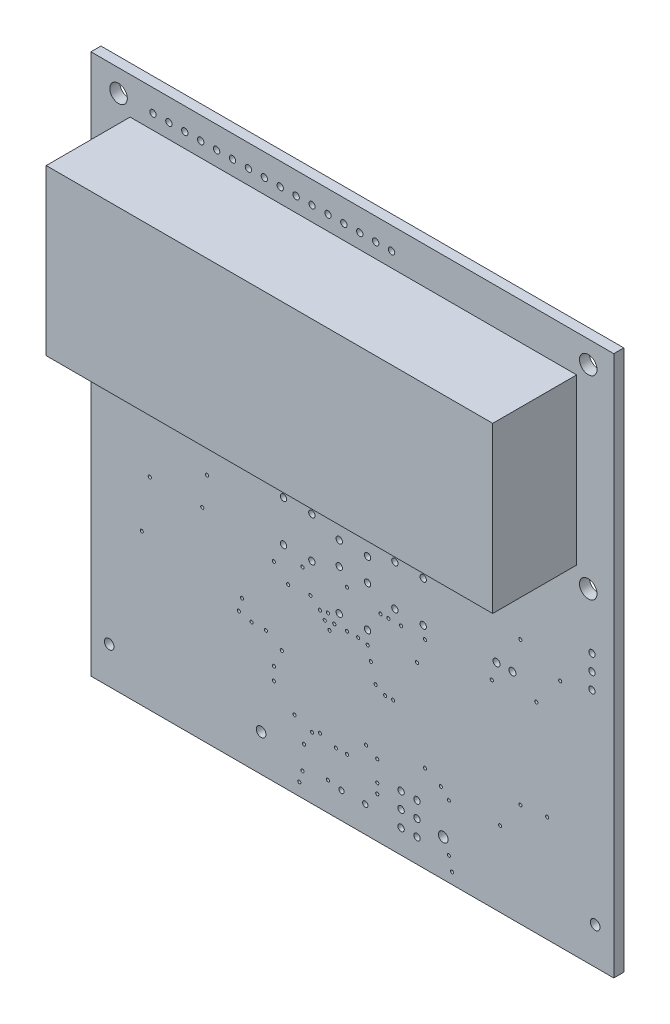
from build123d import *

# Parameters (mm, degrees)
SKETCH_20_W         = 83.49
SKETCH_20_H         = 86.34
SKETCH_20_R         = 0.425
SKETCH_20_R_2       = 0.775
SKETCH_20_R_3       = 1.4
BOSS_EXTRUDE1_DEPTH = 1.6
SKETCH_44_R         = 0.508
SKETCH_44_R_2       = 0.5588
SKETCH_44_R_3       = 0.25
CUT_EXTRUDE3_DEPTH  = 1.6
SKETCH18_W          = 71.3
SKETCH18_H          = 26.3
BOSS_EXTRUDE3_DEPTH = 15


with BuildPart() as part:
    # Sketch 20 → Boss-Extrude1 (new body)
    with BuildSketch(Plane.XY):
        with Locations((41.745, 43.19)):
            Rectangle(SKETCH_20_W, SKETCH_20_H)
        with Locations((40.01, 4.232)):
            Circle(SKETCH_20_R, mode=Mode.SUBTRACT)
        with Locations((43.81, 4.232)):
            Circle(SKETCH_20_R, mode=Mode.SUBTRACT)
        with Locations((27.18, 5.91)):
            Circle(SKETCH_20_R_2, mode=Mode.SUBTRACT)
        with Locations((2.92, 5.91)):
            Circle(SKETCH_20_R_2, mode=Mode.SUBTRACT)
        with Locations((80.52, 5.91)):
            Circle(SKETCH_20_R_2, mode=Mode.SUBTRACT)
        with Locations((56.26, 5.91)):
            Circle(SKETCH_20_R_2, mode=Mode.SUBTRACT)
        with Locations((4.41, 82.81)):
            Circle(SKETCH_20_R_3, mode=Mode.SUBTRACT)
        with Locations((4.41, 51.81)):
            Circle(SKETCH_20_R_3, mode=Mode.SUBTRACT)
        with Locations((79.41, 82.81)):
            Circle(SKETCH_20_R_3, mode=Mode.SUBTRACT)
        with Locations((79.41, 51.81)):
            Circle(SKETCH_20_R_3, mode=Mode.SUBTRACT)
    extrude(amount=BOSS_EXTRUDE1_DEPTH)

    # Sketch 44 → Cut-Extrude3 (cut)
    with BuildSketch(Plane.XY):
        with Locations((52.07, 3.81)):
            Circle(SKETCH_44_R)
        with Locations((49.53, 3.81)):
            Circle(SKETCH_44_R)
        with Locations((52.07, 6.35)):
            Circle(SKETCH_44_R)
        with Locations((49.53, 6.35)):
            Circle(SKETCH_44_R)
        with Locations((52.07, 8.89)):
            Circle(SKETCH_44_R)
        with Locations((49.53, 8.89)):
            Circle(SKETCH_44_R)
        with Locations((67.31, 34.29)):
            Circle(SKETCH_44_R_2)
        with Locations((64.77, 34.29)):
            Circle(SKETCH_44_R_2)
        with Locations((33.02, 58.42)):
            Circle(SKETCH_44_R)
        with Locations((35.56, 58.42)):
            Circle(SKETCH_44_R)
        with Locations((38.1, 58.42)):
            Circle(SKETCH_44_R)
        with Locations((40.64, 58.42)):
            Circle(SKETCH_44_R)
        with Locations((43.18, 58.42)):
            Circle(SKETCH_44_R)
        with Locations((45.72, 58.42)):
            Circle(SKETCH_44_R)
        with Locations((48.26, 58.42)):
            Circle(SKETCH_44_R)
        with Locations((50.8, 58.42)):
            Circle(SKETCH_44_R)
        with Locations((44.1706, 35.0012)):
            Circle(SKETCH_44_R)
        with Locations((44.1706, 28.4988)):
            Circle(SKETCH_44_R)
        with Locations((39.6494, 35.0012)):
            Circle(SKETCH_44_R)
        with Locations((39.6494, 28.4988)):
            Circle(SKETCH_44_R)
        with Locations((44.1706, 45.1612)):
            Circle(SKETCH_44_R)
        with Locations((44.1706, 38.6588)):
            Circle(SKETCH_44_R)
        with Locations((39.6494, 45.1612)):
            Circle(SKETCH_44_R)
        with Locations((39.6494, 38.6588)):
            Circle(SKETCH_44_R)
        with Locations((53.0606, 40.0812)):
            Circle(SKETCH_44_R)
        with Locations((53.0606, 33.5788)):
            Circle(SKETCH_44_R)
        with Locations((48.5394, 40.0812)):
            Circle(SKETCH_44_R)
        with Locations((48.5394, 33.5788)):
            Circle(SKETCH_44_R)
        with Locations((35.2806, 40.0812)):
            Circle(SKETCH_44_R)
        with Locations((35.2806, 33.5788)):
            Circle(SKETCH_44_R)
        with Locations((30.7594, 40.0812)):
            Circle(SKETCH_44_R)
        with Locations((30.7594, 33.5788)):
            Circle(SKETCH_44_R)
        with Locations((80.01, 43.18)):
            Circle(SKETCH_44_R)
        with Locations((80.01, 40.64)):
            Circle(SKETCH_44_R)
        with Locations((80.01, 38.1)):
            Circle(SKETCH_44_R)
        with Locations((9.91, 82.81)):
            Circle(SKETCH_44_R)
        with Locations((12.45, 82.81)):
            Circle(SKETCH_44_R)
        with Locations((14.99, 82.81)):
            Circle(SKETCH_44_R)
        with Locations((17.53, 82.81)):
            Circle(SKETCH_44_R)
        with Locations((20.07, 82.81)):
            Circle(SKETCH_44_R)
        with Locations((22.61, 82.81)):
            Circle(SKETCH_44_R)
        with Locations((25.15, 82.81)):
            Circle(SKETCH_44_R)
        with Locations((27.69, 82.81)):
            Circle(SKETCH_44_R)
        with Locations((30.23, 82.81)):
            Circle(SKETCH_44_R)
        with Locations((32.77, 82.81)):
            Circle(SKETCH_44_R)
        with Locations((35.31, 82.81)):
            Circle(SKETCH_44_R)
        with Locations((37.85, 82.81)):
            Circle(SKETCH_44_R)
        with Locations((40.39, 82.81)):
            Circle(SKETCH_44_R)
        with Locations((42.93, 82.81)):
            Circle(SKETCH_44_R)
        with Locations((45.47, 82.81)):
            Circle(SKETCH_44_R)
        with Locations((48.01, 82.81)):
            Circle(SKETCH_44_R)
        with Locations((25.654, 20.32)):
            Circle(SKETCH_44_R_3)
        with Locations((45.72, 11.43)):
            Circle(SKETCH_44_R_3)
        with Locations((31.496, 28.448)):
            Circle(SKETCH_44_R_3)
        with Locations((44.704, 24.384)):
            Circle(SKETCH_44_R_3)
        with Locations((30.48, 18.796)):
            Circle(SKETCH_44_R_3)
        with Locations((68.58, 16.51)):
            Circle(SKETCH_44_R_3)
        with Locations((29.21, 16.002)):
            Circle(SKETCH_44_R_3)
        with Locations((67.31, 59.69)):
            Circle(SKETCH_44_R_3)
        with Locations((69.85, 64.77)):
            Circle(SKETCH_44_R_3)
        with Locations((48.26, 60.96)):
            Circle(SKETCH_44_R_3)
        with Locations((52.07, 64.77)):
            Circle(SKETCH_44_R_3)
        with Locations((34.29, 64.77)):
            Circle(SKETCH_44_R_3)
        with Locations((39.878, 49.784)):
            Circle(SKETCH_44_R_3)
        with Locations((37.465, 61.595)):
            Circle(SKETCH_44_R_3)
        with Locations((41.402, 49.784)):
            Circle(SKETCH_44_R_3)
        with Locations((21.59, 59.69)):
            Circle(SKETCH_44_R_3)
        with Locations((16.51, 64.77)):
            Circle(SKETCH_44_R_3)
        with Locations((42.672, 49.784)):
            Circle(SKETCH_44_R_3)
        with Locations((43.942, 49.784)):
            Circle(SKETCH_44_R_3)
        with Locations((36.576, 10.414)):
            Circle(SKETCH_44_R_3)
        with Locations((40.894, 9.652)):
            Circle(SKETCH_44_R_3)
        with Locations((35.306, 9.906)):
            Circle(SKETCH_44_R_3)
        with Locations((39.116, 9.652)):
            Circle(SKETCH_44_R_3)
        with Locations((62.23, 46.99)):
            Circle(SKETCH_44_R_3)
        with Locations((48.26, 20.828)):
            Circle(SKETCH_44_R_3)
        with Locations((24.13, 22.86)):
            Circle(SKETCH_44_R_3)
        with Locations((40.894, 26.67)):
            Circle(SKETCH_44_R_3)
        with Locations((40.894, 32.766)):
            Circle(SKETCH_44_R_3)
        with Locations((37.846, 27.686)):
            Circle(SKETCH_44_R_3)
        with Locations((47.498, 31.75)):
            Circle(SKETCH_44_R_3)
        with Locations((49.53, 31.75)):
            Circle(SKETCH_44_R_3)
        with Locations((53.34, 31.75)):
            Circle(SKETCH_44_R_3)
        with Locations((64.008, 31.496)):
            Circle(SKETCH_44_R_3)
        with Locations((8.128, 24.13)):
            Circle(SKETCH_44_R_3)
        with Locations((38.862, 26.67)):
            Circle(SKETCH_44_R_3)
        with Locations((55.88, 12.7)):
            Circle(SKETCH_44_R_3)
        with Locations((32.512, 10.922)):
            Circle(SKETCH_44_R_3)
        with Locations((67.945, 78.105)):
            Circle(SKETCH_44_R_3)
        with Locations((59.055, 78.105)):
            Circle(SKETCH_44_R_3)
        with Locations((50.165, 78.105)):
            Circle(SKETCH_44_R_3)
        with Locations((41.275, 78.105)):
            Circle(SKETCH_44_R_3)
        with Locations((35.687, 74.295)):
            Circle(SKETCH_44_R_3)
        with Locations((23.495, 78.105)):
            Circle(SKETCH_44_R_3)
        with Locations((5.715, 78.105)):
            Circle(SKETCH_44_R_3)
        with Locations((14.605, 78.105)):
            Circle(SKETCH_44_R_3)
        with Locations((13.208, 65.532)):
            Circle(SKETCH_44_R_3)
        with Locations((48.768, 65.532)):
            Circle(SKETCH_44_R_3)
        with Locations((66.548, 65.532)):
            Circle(SKETCH_44_R_3)
        with Locations((57.658, 65.532)):
            Circle(SKETCH_44_R_3)
        with Locations((75.438, 65.532)):
            Circle(SKETCH_44_R_3)
        with Locations((39.878, 65.532)):
            Circle(SKETCH_44_R_3)
        with Locations((22.098, 65.532)):
            Circle(SKETCH_44_R_3)
        with Locations((69.088, 61.722)):
            Circle(SKETCH_44_R_3)
        with Locations((51.308, 61.976)):
            Circle(SKETCH_44_R_3)
        with Locations((34.29, 62.23)):
            Circle(SKETCH_44_R_3)
        with Locations((15.748, 61.722)):
            Circle(SKETCH_44_R_3)
        with Locations((61.976, 42.926)):
            Circle(SKETCH_44_R_3)
        with Locations((68.58, 39.37)):
            Circle(SKETCH_44_R_3)
        with Locations((71.12, 32.004)):
            Circle(SKETCH_44_R_3)
        with Locations((38.862, 56.134)):
            Circle(SKETCH_44_R_3)
        with Locations((48.006, 52.324)):
            Circle(SKETCH_44_R_3)
        with Locations((48.006, 47.244)):
            Circle(SKETCH_44_R_3)
        with Locations((66.04, 49.53)):
            Circle(SKETCH_44_R_3)
        with Locations((52.07, 27.94)):
            Circle(SKETCH_44_R_3)
        with Locations((53.34, 13.97)):
            Circle(SKETCH_44_R_3)
        with Locations((45.72, 6.604)):
            Circle(SKETCH_44_R_3)
        with Locations((34.036, 7.62)):
            Circle(SKETCH_44_R_3)
        with Locations((9.398, 32.258)):
            Circle(SKETCH_44_R_3)
        with Locations((17.78, 32.258)):
            Circle(SKETCH_44_R_3)
        with Locations((18.542, 37.084)):
            Circle(SKETCH_44_R_3)
        with Locations((33.782, 32.004)):
            Circle(SKETCH_44_R_3)
        with Locations((35.56, 69.85)):
            Circle(SKETCH_44_R_3)
        with Locations((49.53, 45.72)):
            Circle(SKETCH_44_R_3)
        with Locations((29.21, 13.97)):
            Circle(SKETCH_44_R_3)
        with Locations((42.672, 26.67)):
            Circle(SKETCH_44_R_3)
        with Locations((8.89, 44.45)):
            Circle(SKETCH_44_R_3)
        with Locations((36.576, 27.432)):
            Circle(SKETCH_44_R_3)
        with Locations((29.21, 30.48)):
            Circle(SKETCH_44_R_3)
        with Locations((27.94, 20.32)):
            Circle(SKETCH_44_R_3)
        with Locations((43.942, 12.446)):
            Circle(SKETCH_44_R_3)
        with Locations((31.75, 41.91)):
            Circle(SKETCH_44_R_3)
        with Locations((35.052, 28.702)):
            Circle(SKETCH_44_R_3)
        with Locations((37.338, 26.416)):
            Circle(SKETCH_44_R_3)
        with Locations((38.1, 25.4)):
            Circle(SKETCH_44_R_3)
        with Locations((33.274, 2.032)):
            Circle(SKETCH_44_R_3)
        with Locations((23.622, 20.828)):
            Circle(SKETCH_44_R_3)
        with Locations((72.85, 16.97)):
            Circle(SKETCH_44_R_3)
        with Locations((57.658, 1.778)):
            Circle(SKETCH_44_R_3)
        with Locations((74.93, 36.83)):
            Circle(SKETCH_44_R_3)
        with Locations((64.77, 58.42)):
            Circle(SKETCH_44_R_3)
        with Locations((8.89, 67.31)):
            Circle(SKETCH_44_R_3)
        with Locations((45.72, 8.128)):
            Circle(SKETCH_44_R_3)
        with Locations((33.782, 3.81)):
            Circle(SKETCH_44_R_3)
        with Locations((57.15, 3.81)):
            Circle(SKETCH_44_R_3)
        with Locations((65.35, 12.01)):
            Circle(SKETCH_44_R_3)
        with Locations((39.37, 41.91)):
            Circle(SKETCH_44_R_3)
        with Locations((44.196, 26.416)):
            Circle(SKETCH_44_R_3)
        with Locations((49.53, 53.34)):
            Circle(SKETCH_44_R_3)
        with Locations((45.466, 21.59)):
            Circle(SKETCH_44_R_3)
        with Locations((46.99, 20.828)):
            Circle(SKETCH_44_R_3)
        with Locations((46.228, 31.75)):
            Circle(SKETCH_44_R_3)
        with Locations((57.15, 11.43)):
            Circle(SKETCH_44_R_3)
        with Locations((37.846, 4.572)):
            Circle(SKETCH_44_R_3)
    extrude(amount=CUT_EXTRUDE3_DEPTH, mode=Mode.SUBTRACT)

    # Sketch18 → Boss-Extrude3 (add)
    with BuildSketch(Plane.XY):
        with Locations((41.91, 67.31)):
            Rectangle(SKETCH18_W, SKETCH18_H)
    extrude(amount=BOSS_EXTRUDE3_DEPTH)


solid = part.part
